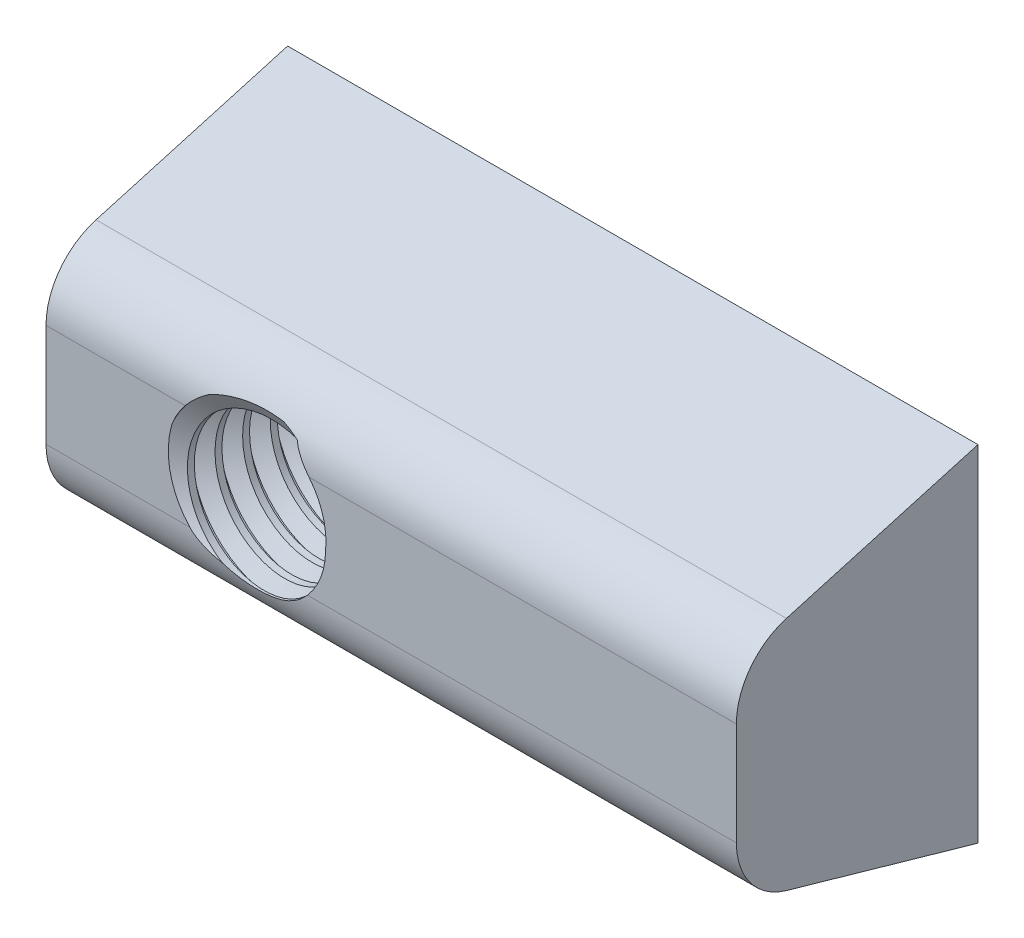
from build123d import *
from build123d.topology import SkipClean

# Parameters (mm, degrees)
SKETCH1_W                      = 20
SKETCH1_H                      = 10
BOSS_EXTRUDE1_DEPTH            = 7
CUT_EXTRUDE1_DEPTH             = 24.430749028
FILLET1_R                      = 2
F_4_2_4_2_DIAMETER_HOLE1_D     = 4.2
F_4_2_4_2_DIAMETER_HOLE1_DEPTH = 8
F_4_2_4_2_DIAMETER_HOLE1_TIP   = 1.2618073
THREAD1_PITCH                  = 0.8


with BuildPart() as part:
    # Sketch1 → Boss-Extrude1 (new body)
    with BuildSketch(Plane.XY):
        with Locations((10, -5)):
            Rectangle(SKETCH1_W, SKETCH1_H)
    extrude(amount=BOSS_EXTRUDE1_DEPTH)

    # Sketch2 → Cut-Extrude1 (cut, through all)
    with BuildSketch(Plane.ZY):
        Polygon((0, 0), (7, -2), (7, 0), align=None)
        Polygon((0, -10), (7, -8), (7, -10), align=None)
    extrude(amount=-CUT_EXTRUDE1_DEPTH, mode=Mode.SUBTRACT)

    # Fillet1
    fillet1_edges = [part.edges().sort_by_distance(p)[0] for p in [
        (10, -2, 7),
        (10, -8, 7),
    ]]
    fillet(fillet1_edges, radius=FILLET1_R)

    # Ø4.2 (4.2) Diameter Hole1
    with Locations(Plane.XY.offset(7)):
        with Locations((6, -5.099589264)):
            Hole(F_4_2_4_2_DIAMETER_HOLE1_D / 2, depth=F_4_2_4_2_DIAMETER_HOLE1_DEPTH)
            with Locations((0, 0, -(F_4_2_4_2_DIAMETER_HOLE1_DEPTH + F_4_2_4_2_DIAMETER_HOLE1_TIP / 2))):  # 118° drill point
                Cone(0, F_4_2_4_2_DIAMETER_HOLE1_D / 2, F_4_2_4_2_DIAMETER_HOLE1_TIP, mode=Mode.SUBTRACT)

    # Thread1: the profile of Thread Profile1 profile screwed along a right-hand helix of 8.75 turns, 8 arcs to a turn; built about Z, then put on its axis
    with SkipClean():  # the faces are left unmerged after this step: merging them gives an invalid solid
        thread1_z = Axis((0, 0, 0), (0, 0, 1))
        thread1_corners = [(2.0997, 0, -0.000173205), (2.5330127, 0, 0.249999999), (2.5330127, 0, 0.349999999), (2.0997, 0, 0.600173203)]
        with BuildLine(mode=Mode.PRIVATE) as thread1_profile:
            Line(thread1_corners[0], thread1_corners[1])
            Line(thread1_corners[1], thread1_corners[2])
            Line(thread1_corners[2], thread1_corners[3])
            Line(thread1_corners[3], thread1_corners[0])
        thread1_cap = Face(thread1_profile.wire())
        thread1_turn_angles = [0, 22.5, 45, 67.5, 90, 112.5, 135, 157.5, 180, 202.5, 225, 247.5, 270, 292.5, 315, 337.5, 360]
        thread1_turn_weights = [1, 0.9238795325112867, 1, 0.9238795325112867, 1, 0.9238795325112867, 1, 0.9238795325112867, 1, 0.9238795325112867, 1, 0.9238795325112867, 1, 0.9238795325112867, 1, 0.9238795325112867, 1]
        thread1_turn_rails = [Edge.make_bspline([Vector(p[0], p[1], 0).rotate(thread1_z, thread1_turn_angles[k]) / thread1_turn_weights[k] + Vector(0, 0, p[2] + THREAD1_PITCH * thread1_turn_angles[k] / 360) for k in range(17)], [0, 0, 0, 1, 1, 2, 2, 3, 3, 4, 4, 5, 5, 6, 6, 7, 7, 8, 8, 8], 2, thread1_turn_weights) for p in thread1_corners]
        thread1_turn_sides = [Face.make_surface_from_curves(thread1_turn_rails[p[0]], thread1_turn_rails[p[1]]) for p in [(0, 1), (1, 2), (2, 3), (3, 0)]]
        thread1_last_angles = [2880, 2902.5, 2925, 2947.5, 2970, 2992.5, 3015, 3037.5, 3060, 3082.5, 3105, 3127.5, 3150]
        thread1_last_weights = [1, 0.9238795325112867, 1, 0.9238795325112867, 1, 0.9238795325112867, 1, 0.9238795325112867, 1, 0.9238795325112867, 1, 0.9238795325112867, 1]
        thread1_last_rails = [Edge.make_bspline([Vector(p[0], p[1], 0).rotate(thread1_z, thread1_last_angles[k]) / thread1_last_weights[k] + Vector(0, 0, p[2] + THREAD1_PITCH * thread1_last_angles[k] / 360) for k in range(13)], [0, 0, 0, 1, 1, 2, 2, 3, 3, 4, 4, 5, 5, 6, 6, 6], 2, thread1_last_weights) for p in thread1_corners]
        thread1_last_sides = [Face.make_surface_from_curves(thread1_last_rails[p[0]], thread1_last_rails[p[1]]) for p in [(0, 1), (1, 2), (2, 3), (3, 0)]]
        thread1 = Plane(origin=(6, -5.099589264, 0), x_dir=(1, 0, 0), z_dir=(0, 0, 1)) * Solid(Shell([*[p.moved(Location((0, 0, THREAD1_PITCH * i))) for i in range(8) for p in thread1_turn_sides], *thread1_last_sides, thread1_cap, thread1_cap.rotate(thread1_z, 3150).moved(Location((0, 0, THREAD1_PITCH * 3150 / 360)))]))
        add(thread1, mode=Mode.SUBTRACT)


solid = part.part
